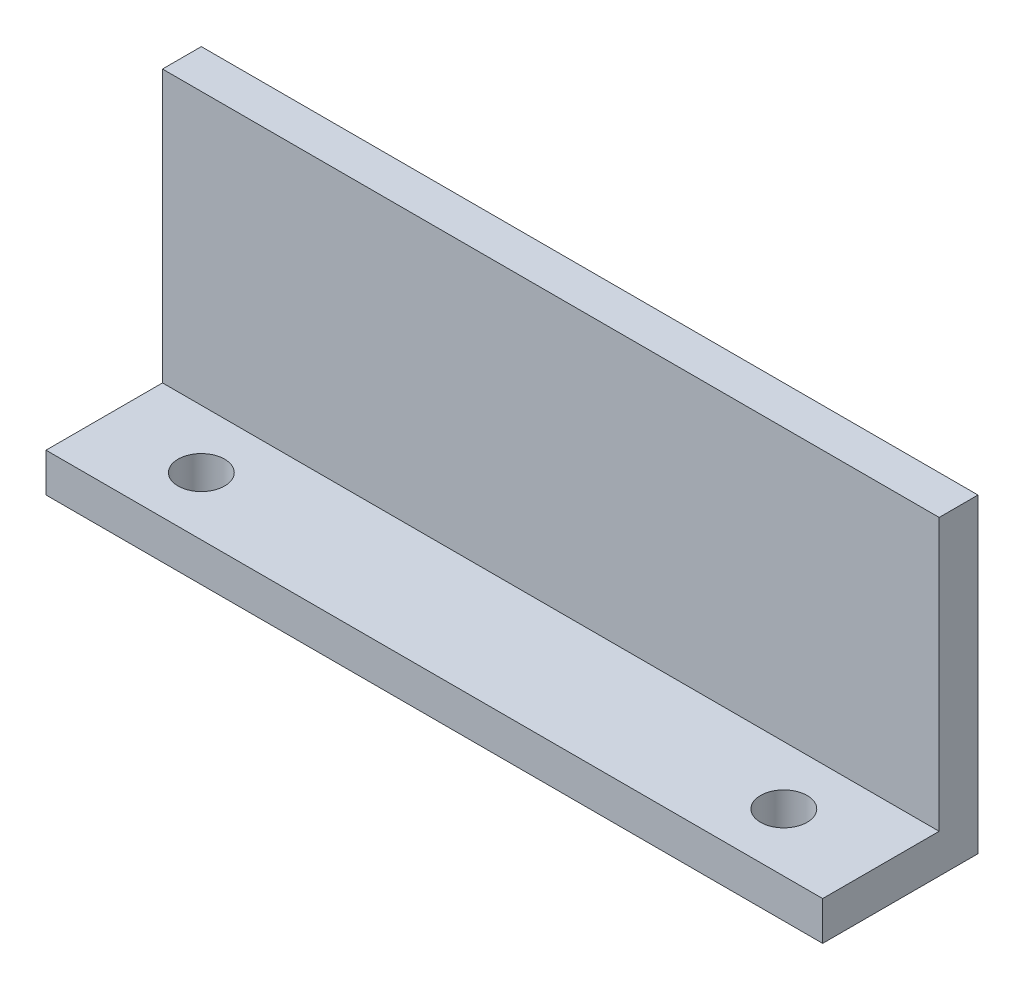
from build123d import *

# Parameters (mm, degrees)
SZKIC1_W                    = 200
SZKIC1_H                    = 80
DODANIE_WYCI_GNI_CIE1_DEPTH = 10
SZKIC2_W                    = 200
SZKIC2_H                    = 10
DODANIE_WYCI_GNI_CIE2_DEPTH = 30
OTW_R_POD_RUB_M101_D        = 12
SZYK_LINIOWY2_COUNT         = 2
SZYK_LINIOWY2_PITCH         = 150


with BuildPart() as part:
    # Szkic1 → Dodanie-wyciągnięcie1 (new body)
    with BuildSketch(Plane.XY):
        Rectangle(SZKIC1_W, SZKIC1_H)
    extrude(amount=DODANIE_WYCI_GNI_CIE1_DEPTH)

    # Szkic2 → Dodanie-wyciągnięcie2 (add)
    with BuildSketch(Plane.XY.offset(10)):
        with Locations((0, -35)):
            Rectangle(SZKIC2_W, SZKIC2_H)
    extrude(amount=DODANIE_WYCI_GNI_CIE2_DEPTH)

    # Otwór pod śrubę M101 (through all)
    with Locations(Plane(origin=(0, -30, 0), x_dir=(1, 0, 0), z_dir=(0, 1, 0))):
        with Locations((-75, -25)):
            otw_r_pod_rub_m101 = Hole(OTW_R_POD_RUB_M101_D / 2)

    # Szyk liniowy2: Otwór pod śrubę M101 ×2
    with Locations(*[(i * SZYK_LINIOWY2_PITCH, 0, 0) for i in range(1, SZYK_LINIOWY2_COUNT)]):
        add(otw_r_pod_rub_m101, mode=Mode.SUBTRACT)


solid = part.part
